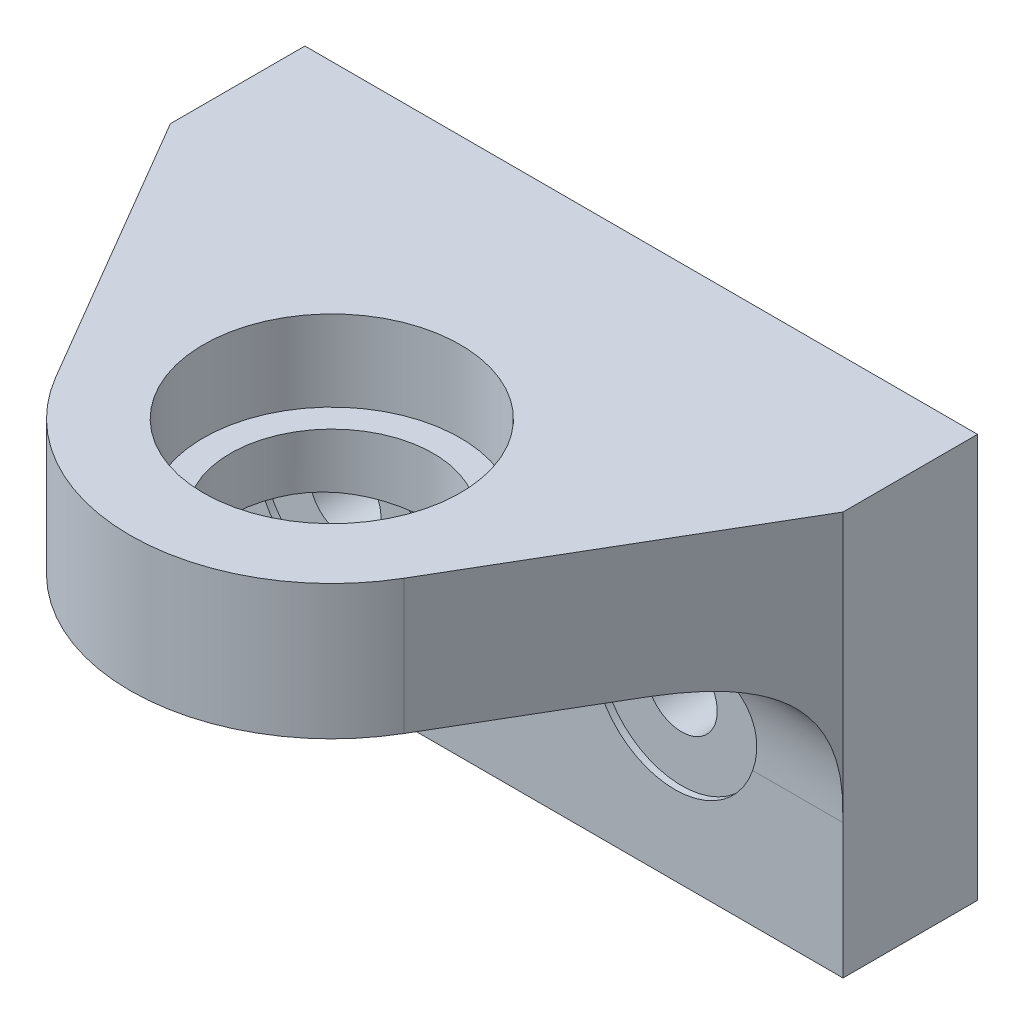
from build123d import *

# Parameters (mm, degrees)
SKETCH1_W                               = 50
SKETCH1_H                               = 30
BOSS_EXTRUDE1_DEPTH                     = 10
BOSS_EXTRUDE3_DEPTH                     = 10
CBORE_FOR_M5_HEX_HEAD_BOLT1_D           = 5.3
CBORE_FOR_M5_HEX_HEAD_BOLT1_CBORE_D     = 12.24
CBORE_FOR_M5_HEX_HEAD_BOLT1_CBORE_DEPTH = 0.5
FILLET1_SIZE                            = 10
SKETCH15_R                              = 9.55
CUT_EXTRUDE1_DEPTH                      = 6
SKETCH16_R                              = 7.55
CUT_EXTRUDE2_DEPTH                      = 52.429563531


with BuildPart() as part:
    # Sketch1 → Boss-Extrude1 (new body)
    with BuildSketch(Plane.XY):
        Rectangle(SKETCH1_W, SKETCH1_H)
    extrude(amount=BOSS_EXTRUDE1_DEPTH)

    # Sketch8 → Boss-Extrude3 (add)
    with BuildSketch(Plane(origin=(0, 15, 0), x_dir=(1, 0, 0), z_dir=(0, 1, 0))):
        with BuildLine():
            Line((-25, -10), (-12.942664449, -30.582047017))
            ThreePointArc((-12.942664449, -30.582047017), (0, -38), (12.942664449, -30.582047017))
            Line((12.942664449, -30.582047017), (25, -10))
            Line((25, -10), (-25, -10))
        make_face()
    extrude(amount=-BOSS_EXTRUDE3_DEPTH)

    # CBORE for M5 Hex Head Bolt1 (through all)
    with Locations(Plane.XY.offset(10)):
        with Locations((12.5, -3), (-12.5, -3)):
            CounterBoreHole(CBORE_FOR_M5_HEX_HEAD_BOLT1_D / 2, CBORE_FOR_M5_HEX_HEAD_BOLT1_CBORE_D / 2, CBORE_FOR_M5_HEX_HEAD_BOLT1_CBORE_DEPTH)

    # Fillet1
    # a fillet whose section is not a circle: 10 mm, written as the material it adds along each edge
    with BuildSketch(Plane(origin=(50, 5, 10), x_dir=(0, -1, 0), z_dir=(-1, 0, 0))) as fillet1_piece_1_section:
        with BuildLine():
            add(Edge.make_bspline([(FILLET1_SIZE, 0), (FILLET1_SIZE * 0.831801948466, 0), (FILLET1_SIZE * 0.663603896932, 0), (FILLET1_SIZE * 0.292893218813, FILLET1_SIZE * 0.0716919198361), (FILLET1_SIZE * 0.0716919198361, FILLET1_SIZE * 0.292893218813), (0, FILLET1_SIZE * 0.663603896932), (0, FILLET1_SIZE * 0.831801948466), (0, FILLET1_SIZE)], knots=[0, 0, 0, 0, 0, 0, 0.5, 0.5, 1, 1, 1, 1, 1, 1], degree=5))
            Line((0, FILLET1_SIZE), (0, 0))
            Line((0, 0), (FILLET1_SIZE, 0))
        make_face()
    fillet1_piece_1 = extrude(amount=100, mode=Mode.PRIVATE)
    fillet1_piece_1 = split(fillet1_piece_1, bisect_by=Plane(origin=(-5.837521011, 5, 42.710630125), z_dir=(0.8628442965853785, 0, -0.5054698011257285)), keep=Keep.TOP, mode=Mode.PRIVATE)
    fillet1_piece_1 = split(fillet1_piece_1, bisect_by=Plane(origin=(31.387492996, 5, -0.903543375), z_dir=(-0.8628442965853789, 0, -0.5054698011257279)), keep=Keep.TOP, mode=Mode.PRIVATE)
    fillet1_piece_1 = fillet1_piece_1 - Plane(origin=(12.5, -3, 10), x_dir=(1, 0, 0), z_dir=(0, 0, 1)) * Cylinder(6.12, 240, mode=Mode.PRIVATE)
    fillet1_piece_1 = fillet1_piece_1 - Plane(origin=(-12.5, -3, 10), x_dir=(1, 0, 0), z_dir=(0, 0, 1)) * Cylinder(6.12, 240, mode=Mode.PRIVATE)
    add(fillet1_piece_1)

    # Sketch15 → Cut-Extrude1 (cut)
    with BuildSketch(Plane(origin=(0, 15, 0), x_dir=(1, 0, 0), z_dir=(0, 1, 0))):
        with Locations(Location((0, -23, 0), (0, 0, 270))):
            Circle(SKETCH15_R)
    extrude(amount=-CUT_EXTRUDE1_DEPTH, mode=Mode.SUBTRACT)

    # Sketch16 → Cut-Extrude2 (cut, through all)
    with BuildSketch(Plane(origin=(0, 9, 0), x_dir=(1, 0, 0), z_dir=(0, 1, 0))):
        with Locations(Location((0, -23, 0), (0, 0, 270))):
            Circle(SKETCH16_R)
    extrude(amount=-CUT_EXTRUDE2_DEPTH, mode=Mode.SUBTRACT)


solid = part.part
